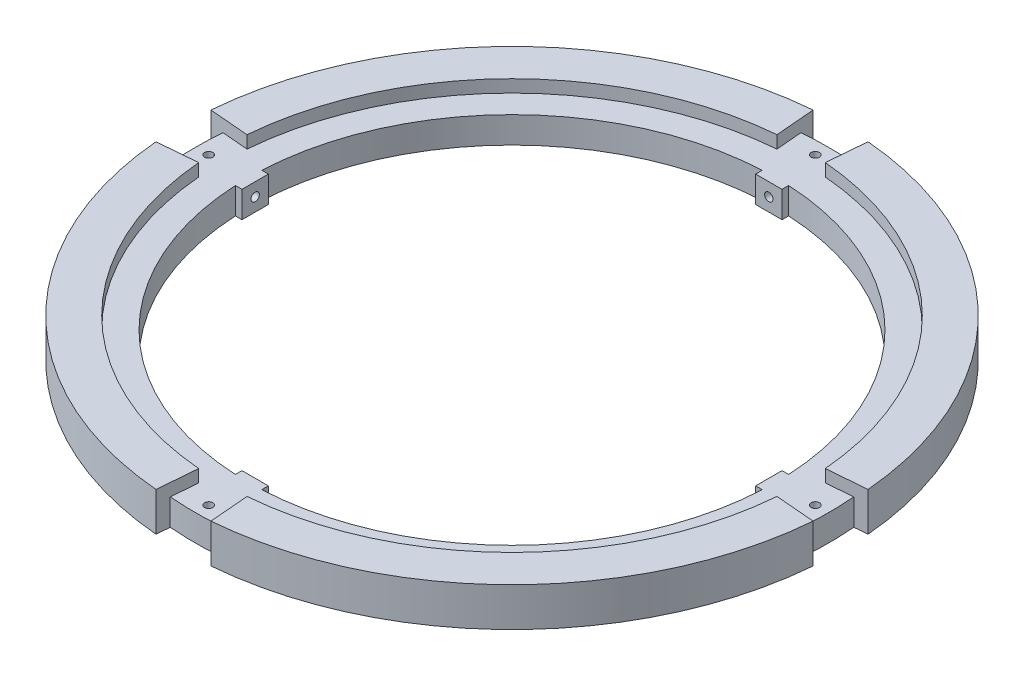
from build123d import *

# Parameters (mm, degrees)
SKETCH1_R           = 152.4
SKETCH1_R_2         = 139.7
BOSS_EXTRUDE1_DEPTH = 18.7
SKETCH1_3_R         = 139.7
SKETCH1_3_R_2       = 127
BOSS_EXTRUDE2_DEPTH = 12.7
BOSS_EXTRUDE3_DEPTH = 12.7
SKETCH3_R           = 2
CUT_EXTRUDE1_DEPTH  = 25.4
CIRPATTERN1_COUNT   = 4
CUT_EXTRUDE4_START  = -6
CUT_EXTRUDE4_DEPTH  = 6
SKETCH5_R           = 2
CUT_EXTRUDE5_DEPTH  = 12.7
CIRPATTERN2_COUNT   = 4
BOSS_EXTRUDE4_START = -18.7
BOSS_EXTRUDE4_DEPTH = 18.7
CIRPATTERN3_COUNT   = 4


with BuildPart() as part:
    # Sketch1 → Boss-Extrude1 (new body)
    with BuildSketch(Plane(origin=(0, 0, 0), x_dir=(1, 0, 0), z_dir=(0, 1, 0))):
        Circle(SKETCH1_R)
        Circle(SKETCH1_R_2, mode=Mode.SUBTRACT)
    extrude(amount=BOSS_EXTRUDE1_DEPTH)

    # Sketch1<3> → Boss-Extrude2 (add)
    with BuildSketch(Plane(origin=(0, 0, 0), x_dir=(1, 0, 0), z_dir=(0, 1, 0))):
        Circle(SKETCH1_3_R)
        Circle(SKETCH1_3_R_2, mode=Mode.SUBTRACT)
    extrude(amount=BOSS_EXTRUDE2_DEPTH)

    # Sketch2 → Boss-Extrude3 (add)
    with BuildSketch(Plane.XZ):
        with BuildLine():
            ThreePointArc((-6.35, -126.841150657), (0, -127), (6.35, -126.841150657))
            Line((6.35, -126.841150657), (6.35, -123.666150657))
            Line((6.35, -123.666150657), (-6.35, -123.666150657))
            Line((-6.35, -123.666150657), (-6.35, -126.841150657))
        make_face()
        with BuildLine():
            ThreePointArc((-126.841150657, 6.35), (-127, 0), (-126.841150657, -6.35))
            Line((-126.841150657, -6.35), (-123.666150657, -6.35))
            Line((-123.666150657, -6.35), (-123.666150657, 6.35))
            Line((-123.666150657, 6.35), (-126.841150657, 6.35))
        make_face()
        with BuildLine():
            Line((123.666150657, -6.35), (126.841150657, -6.35))
            ThreePointArc((126.841150657, -6.35), (127, 0), (126.841150657, 6.35))
            Line((126.841150657, 6.35), (123.666150657, 6.35))
            Line((123.666150657, 6.35), (123.666150657, -6.35))
        make_face()
        with BuildLine():
            ThreePointArc((6.35, 126.841150657), (0, 127), (-6.35, 126.841150657))
            Line((-6.35, 126.841150657), (-6.35, 123.666150657))
            Line((-6.35, 123.666150657), (6.35, 123.666150657))
            Line((6.35, 123.666150657), (6.35, 126.841150657))
        make_face()
    extrude(amount=-BOSS_EXTRUDE3_DEPTH)

    # Sketch3 → Cut-Extrude1 (cut)
    with BuildSketch(Plane(origin=(-123.666150657, 0, 0), x_dir=(0, 0, -1), z_dir=(1, 0, 0))):
        with Locations((0, 6.35)):
            Circle(SKETCH3_R)
    cut_extrude1 = extrude(amount=-CUT_EXTRUDE1_DEPTH, mode=Mode.SUBTRACT)

    # CirPattern1: Cut-Extrude1 ×4 about axis
    cirpattern1_axis = Axis((0, 12.7, 0), (0, 1, 0))
    for i in range(1, CIRPATTERN1_COUNT):
        add(cut_extrude1.rotate(cirpattern1_axis, i * 360 / CIRPATTERN1_COUNT), mode=Mode.SUBTRACT)

    # Sketch4 → Cut-Extrude4 (cut)
    with BuildSketch(Plane(origin=(0, 18.7, 0), x_dir=(1, 0, 0), z_dir=(0, 1, 0)).offset(CUT_EXTRUDE4_START)):
        with BuildLine():
            ThreePointArc((-139.214085484, -11.641666667), (-139.699999908, -0.00507263), (-139.214930556, 11.631556663))
            Line((-139.214930556, 11.631556663), (-151.870833333, 12.688970905))
            ThreePointArc((-151.870833333, 12.688970905), (-152.3999999, -0.005533779), (-151.869911437, -12.7))
            Line((-151.869911437, -12.7), (-139.214085484, -11.641666667))
        make_face()
    cut_extrude4 = extrude(amount=CUT_EXTRUDE4_DEPTH, mode=Mode.SUBTRACT)

    # Sketch5 → Cut-Extrude5 (cut)
    with BuildSketch(Plane(origin=(0, 12.7, 0), x_dir=(1, 0, 0), z_dir=(0, 1, 0))):
        with Locations((-146.0499999, -0.005533779)):
            Circle(SKETCH5_R)
    cut_extrude5 = extrude(amount=-CUT_EXTRUDE5_DEPTH, mode=Mode.SUBTRACT)

    # CirPattern2: Cut-Extrude4, Cut-Extrude5 ×4 about axis
    cirpattern2_axis = Axis((0, 18.7, 0), (0, 1, 0))
    add([cut_extrude4.rotate(cirpattern2_axis, i * 360 / CIRPATTERN2_COUNT) for i in range(1, CIRPATTERN2_COUNT)], mode=Mode.SUBTRACT)
    add([cut_extrude5.rotate(cirpattern2_axis, i * 360 / CIRPATTERN2_COUNT) for i in range(1, CIRPATTERN2_COUNT)], mode=Mode.SUBTRACT)

    # Sketch6 → Boss-Extrude4 (add)
    with BuildSketch(Plane(origin=(0, 18.7, 0), x_dir=(1, 0, 0), z_dir=(0, 1, 0)).offset(BOSS_EXTRUDE4_START)):
        with BuildLine():
            Line((-158.198784722, 13.217678026), (-151.870833333, 12.688970905))
            ThreePointArc((-151.870833333, 12.688970905), (-107.766986354, 107.759160409), (-12.7, 151.869911437))
            Line((-12.7, 151.869911437), (-13.229166667, 158.197824414))
            ThreePointArc((-13.229166667, 158.197824414), (-112.257277452, 112.249125427), (-158.198784722, 13.217678026))
        make_face()
    boss_extrude4 = extrude(amount=BOSS_EXTRUDE4_DEPTH)

    # CirPattern3: Boss-Extrude4 ×4 about axis
    cirpattern3_axis = Axis((0, 18.7, 0), (0, 1, 0))
    for i in range(1, CIRPATTERN3_COUNT):
        add(boss_extrude4.rotate(cirpattern3_axis, i * 360 / CIRPATTERN3_COUNT))


solid = part.part
